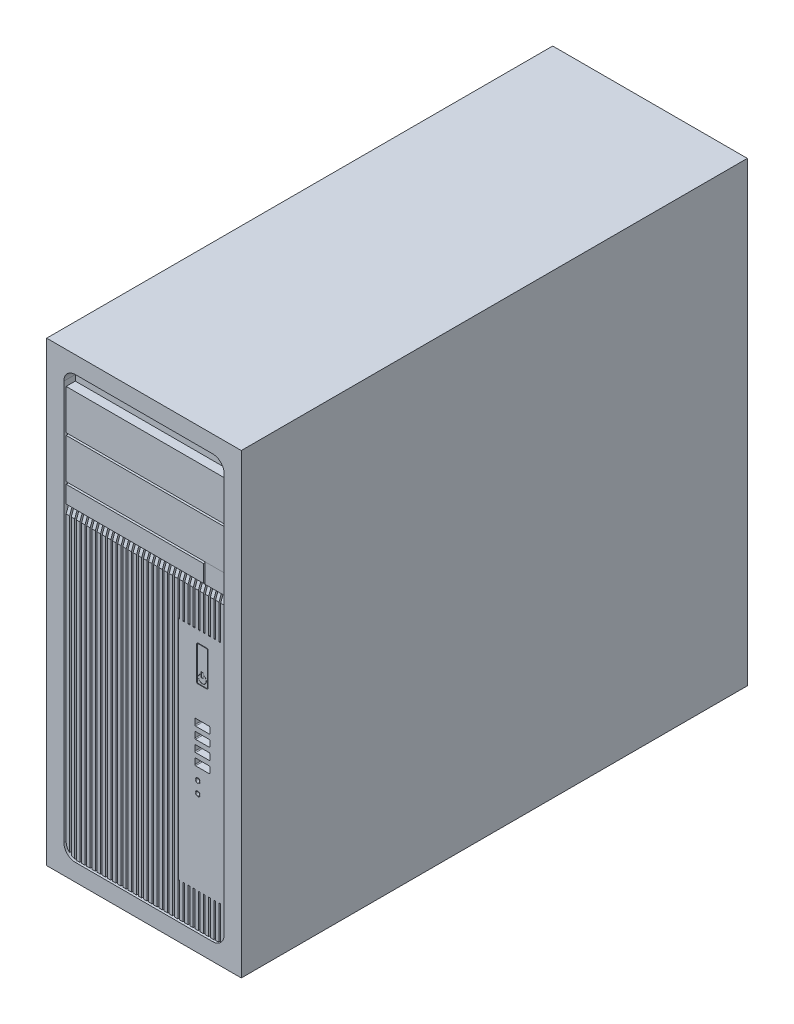
from build123d import *

# Parameters (mm, degrees)
SKETCH1_W             = 170
SKETCH1_H             = 442
BOSS_EXTRUDE1_DEPTH   = 399
CUT_EXTRUDE1_DEPTH    = 10
SKETCH3_W             = 140
SKETCH3_H             = 35
BOSS_EXTRUDE2_DEPTH   = 8
SKETCH4_W             = 120
SKETCH4_H             = 15
BOSS_EXTRUDE3_DEPTH   = 8
SKETCH4_W_2           = 18.906176259
SKETCH4_H_2           = 17
BOSS_EXTRUDE3_2_DEPTH = 8
BOSS_EXTRUDE4_START   = 8
BOSS_EXTRUDE4_DEPTH   = 8
CHAMFER1_SIZE         = 2
CHAMFER1_SIZE2        = 5.494954839
CUT_EXTRUDE2_DEPTH    = 8
SKETCH7_W             = 1.5
SKETCH7_H             = 263
CUT_EXTRUDE3_DEPTH    = 8
BOSS_EXTRUDE5_DEPTH   = 8
SKETCH9_W             = 42
SKETCH9_H             = 197.505045161
BOSS_EXTRUDE6_DEPTH   = 8
CUT_EXTRUDE4_DEPTH    = 8
SKETCH11_W            = 2
SKETCH11_H            = 4.4
SKETCH11_W_2          = 1.6
SKETCH11_H_2          = 4
CUT_EXTRUDE5_DEPTH    = 1
CUT_EXTRUDE6_DEPTH    = 8
SKETCH14_R            = 2.1
SKETCH14_R_2          = 1.9
SKETCH14_R_3          = 1.7
CUT_EXTRUDE7_DEPTH    = 8


with BuildPart() as part:
    # Sketch1 → Boss-Extrude1 (new body)
    with BuildSketch(Plane(origin=(0, 0, 0), x_dir=(1, 0, 0), z_dir=(0, 1, 0))):
        Rectangle(SKETCH1_W, SKETCH1_H)
    extrude(amount=BOSS_EXTRUDE1_DEPTH)

    # Sketch2 → Cut-Extrude1 (cut)
    with BuildSketch(Plane.XY.offset(221)):
        with BuildLine():
            Line((-60, 15), (60, 15))
            ThreePointArc((60, 15), (67.071067812, 17.928932188), (70, 25))
            Line((70, 25), (70, 374))
            ThreePointArc((70, 374), (67.071067812, 381.071067812), (60, 384))
            Line((60, 384), (-60, 384))
            ThreePointArc((-60, 384), (-67.071067812, 381.071067812), (-70, 374))
            Line((-70, 374), (-70, 25))
            ThreePointArc((-70, 25), (-67.071067812, 17.928932188), (-60, 15))
        make_face()
    extrude(amount=-CUT_EXTRUDE1_DEPTH, mode=Mode.SUBTRACT)

    # Sketch3 → Boss-Extrude2 (add)
    with BuildSketch(Plane.XY.offset(211)):
        with Locations((0, 351.5)):
            Rectangle(SKETCH3_W, SKETCH3_H)
        with Locations((0, 314.5)):
            Rectangle(SKETCH3_W, SKETCH3_H)
    extrude(amount=BOSS_EXTRUDE2_DEPTH)

    # Sketch5 → Boss-Extrude4 (add)
    with BuildSketch(Plane.XY.offset(211).offset(BOSS_EXTRUDE4_START)):
        with BuildLine():
            Line((-60, 15), (60, 15))
            ThreePointArc((60, 15), (67.071067812, 17.928932188), (70, 25))
            Line((70, 25), (70, 278))
            Line((70, 278), (-70, 278))
            Line((-70, 278), (-70, 25))
            ThreePointArc((-70, 25), (-67.071067812, 17.928932188), (-60, 15))
        make_face()
    extrude(amount=-BOSS_EXTRUDE4_DEPTH)

    # Chamfer1
    chamfer1_edges = [part.edges().sort_by_distance(p)[0] for p in [
        (0, 278, 219),
    ]]
    chamfer1_side = [part.faces().sort_by_distance(p)[0] for p in [
        (0, 278, 215),
    ]]
    chamfer(chamfer1_edges, length=CHAMFER1_SIZE, length2=CHAMFER1_SIZE2, reference=chamfer1_side[0])

    # Sketch6 → Cut-Extrude2 (cut)
    with BuildSketch(Plane.XY.offset(219)):
        with BuildLine():
            Line((-65.5, 278), (-67, 278))
            Line((-67, 278), (-67, 17.858571571))
            ThreePointArc((-67, 17.858571571), (-66.279224233, 17.217240655), (-65.5, 16.648353456))
            Line((-65.5, 16.648353456), (-65.5, 278))
        make_face()
    extrude(amount=-CUT_EXTRUDE2_DEPTH, mode=Mode.SUBTRACT)

    # Sketch7 → Cut-Extrude3 (cut)
    with BuildSketch(Plane.XY.offset(219)):
        with Locations((-61.75, 146.5)):
            Rectangle(SKETCH7_W, SKETCH7_H)
        with Locations((-57.25, 146.5)):
            Rectangle(SKETCH7_W, SKETCH7_H)
        with Locations((-52.75, 146.5)):
            Rectangle(SKETCH7_W, SKETCH7_H)
        with Locations((-48.25, 146.5)):
            Rectangle(SKETCH7_W, SKETCH7_H)
        with Locations((-43.75, 146.5)):
            Rectangle(SKETCH7_W, SKETCH7_H)
        with Locations((-39.25, 146.5)):
            Rectangle(SKETCH7_W, SKETCH7_H)
        with Locations((-34.75, 146.5)):
            Rectangle(SKETCH7_W, SKETCH7_H)
        with Locations((-30.25, 146.5)):
            Rectangle(SKETCH7_W, SKETCH7_H)
        with Locations((-25.75, 146.5)):
            Rectangle(SKETCH7_W, SKETCH7_H)
        with Locations((-21.25, 146.5)):
            Rectangle(SKETCH7_W, SKETCH7_H)
        with Locations((-16.75, 146.5)):
            Rectangle(SKETCH7_W, SKETCH7_H)
        with Locations((-12.25, 146.5)):
            Rectangle(SKETCH7_W, SKETCH7_H)
        with Locations((-7.75, 146.5)):
            Rectangle(SKETCH7_W, SKETCH7_H)
        with Locations((-3.25, 146.5)):
            Rectangle(SKETCH7_W, SKETCH7_H)
        with Locations((1.25, 146.5)):
            Rectangle(SKETCH7_W, SKETCH7_H)
        with Locations((5.75, 146.5)):
            Rectangle(SKETCH7_W, SKETCH7_H)
        with Locations((10.25, 146.5)):
            Rectangle(SKETCH7_W, SKETCH7_H)
        with Locations((14.75, 146.5)):
            Rectangle(SKETCH7_W, SKETCH7_H)
        with Locations((19.25, 146.5)):
            Rectangle(SKETCH7_W, SKETCH7_H)
        with Locations((23.75, 146.5)):
            Rectangle(SKETCH7_W, SKETCH7_H)
        with Locations((28.25, 146.5)):
            Rectangle(SKETCH7_W, SKETCH7_H)
        with Locations((32.75, 146.5)):
            Rectangle(SKETCH7_W, SKETCH7_H)
        with Locations((37.25, 146.5)):
            Rectangle(SKETCH7_W, SKETCH7_H)
        with Locations((41.75, 146.5)):
            Rectangle(SKETCH7_W, SKETCH7_H)
        with Locations((46.25, 146.5)):
            Rectangle(SKETCH7_W, SKETCH7_H)
        with Locations((50.75, 146.5)):
            Rectangle(SKETCH7_W, SKETCH7_H)
        with Locations((55.25, 146.5)):
            Rectangle(SKETCH7_W, SKETCH7_H)
        with Locations((59.75, 146.5)):
            Rectangle(SKETCH7_W, SKETCH7_H)
        with Locations((64.25, 146.5)):
            Rectangle(SKETCH7_W, SKETCH7_H)
        with Locations((68.75, 146.5)):
            Rectangle(SKETCH7_W, SKETCH7_H)
    extrude(amount=-CUT_EXTRUDE3_DEPTH, mode=Mode.SUBTRACT)

    # Sketch8 → Boss-Extrude5 (add)
    with BuildSketch(Plane.XY.offset(219)):
        with BuildLine():
            ThreePointArc((60.5, 15.012507822), (60.250078211, 15.003127445), (60, 15))
            Line((60, 15), (70, 15))
            Line((70, 15), (70, 25))
            ThreePointArc((70, 25), (68.215838363, 19.299122875), (63.5, 15.632503002))
            ThreePointArc((63.5, 15.632503002), (62.023882039, 15.206946263), (60.5, 15.012507822))
        make_face()
    extrude(amount=-BOSS_EXTRUDE5_DEPTH)

    # Sketch9 → Boss-Extrude6 (add)
    with BuildSketch(Plane.XY.offset(219)):
        with Locations((49, 143.75252258)):
            Rectangle(SKETCH9_W, SKETCH9_H)
    extrude(amount=-BOSS_EXTRUDE6_DEPTH)

    # Sketch10 → Cut-Extrude4 (cut)
    with BuildSketch(Plane.XY.offset(219)):
        with BuildLine():
            Line((45.057177858, 201.505045161), (52.942822142, 201.505045161))
            ThreePointArc((52.942822142, 201.505045161), (53.649928923, 201.79793838), (53.942822142, 202.505045161))
            Line((53.942822142, 202.505045161), (53.942822142, 231.505045161))
            ThreePointArc((53.942822142, 231.505045161), (53.649928923, 232.212151942), (52.942822142, 232.505045161))
            Line((52.942822142, 232.505045161), (45.057177858, 232.505045161))
            ThreePointArc((45.057177858, 232.505045161), (44.350071077, 232.212151942), (44.057177858, 231.505045161))
            Line((44.057177858, 231.505045161), (44.057177858, 202.505045161))
            ThreePointArc((44.057177858, 202.505045161), (44.350071077, 201.79793838), (45.057177858, 201.505045161))
        make_face()
        with BuildLine():
            Line((45.557177858, 202.005045161), (52.442822142, 202.005045161))
            ThreePointArc((52.442822142, 202.005045161), (53.149928923, 202.29793838), (53.442822142, 203.005045161))
            Line((53.442822142, 203.005045161), (53.442822142, 231.005045161))
            ThreePointArc((53.442822142, 231.005045161), (53.149928923, 231.712151942), (52.442822142, 232.005045161))
            Line((52.442822142, 232.005045161), (45.557177858, 232.005045161))
            ThreePointArc((45.557177858, 232.005045161), (44.850071077, 231.712151942), (44.557177858, 231.005045161))
            Line((44.557177858, 231.005045161), (44.557177858, 203.005045161))
            ThreePointArc((44.557177858, 203.005045161), (44.850071077, 202.29793838), (45.557177858, 202.005045161))
        make_face(mode=Mode.SUBTRACT)
    extrude(amount=-CUT_EXTRUDE4_DEPTH, mode=Mode.SUBTRACT)

    # Sketch11 → Cut-Extrude5 (cut)
    # profile 1 of 2: a face of its own
    with BuildSketch(Plane.XY.offset(219)):
        with BuildLine():
            ThreePointArc((47.467219873, 210.15156468), (49, 203.505045161), (50.532780127, 210.15156468))
            Line((50.532780127, 210.15156468), (50.532780127, 209.927473104))
            ThreePointArc((50.532780127, 209.927473104), (49, 203.705045161), (47.467219873, 209.927473104))
            Line((47.467219873, 209.927473104), (47.467219873, 210.15156468))
        make_face()
    # profile 2 of 2: a face of its own
    with BuildSketch(Plane.XY.offset(219)):
        with Locations((49, 210.005045161)):
            Rectangle(SKETCH11_W, SKETCH11_H)
        with Locations((49, 210.005045161)):
            Rectangle(SKETCH11_W_2, SKETCH11_H_2, mode=Mode.SUBTRACT)
    extrude(amount=-CUT_EXTRUDE5_DEPTH, mode=Mode.SUBTRACT)

    # Sketch13 → Cut-Extrude6 (cut)
    with BuildSketch(Plane.XY.offset(219)):
        with BuildLine():
            ThreePointArc((42.35, 169.305045161), (42.572598846, 168.767644007), (43.11, 168.545045161))
            Line((43.11, 168.545045161), (54.89, 168.545045161))
            ThreePointArc((54.89, 168.545045161), (55.427401154, 168.767644007), (55.65, 169.305045161))
            Line((55.65, 169.305045161), (55.65, 173.705045161))
            ThreePointArc((55.65, 173.705045161), (55.427401154, 174.242446315), (54.89, 174.465045161))
            Line((54.89, 174.465045161), (43.11, 174.465045161))
            ThreePointArc((43.11, 174.465045161), (42.572598846, 174.242446315), (42.35, 173.705045161))
            Line((42.35, 173.705045161), (42.35, 169.305045161))
        make_face()
        with BuildLine():
            Line((42.35, 163.705045161), (42.35, 159.305045161))
            ThreePointArc((42.35, 159.305045161), (42.572598846, 158.767644007), (43.11, 158.545045161))
            Line((43.11, 158.545045161), (54.89, 158.545045161))
            ThreePointArc((54.89, 158.545045161), (55.427401154, 158.767644007), (55.65, 159.305045161))
            Line((55.65, 159.305045161), (55.65, 163.705045161))
            ThreePointArc((55.65, 163.705045161), (55.427401154, 164.242446315), (54.89, 164.465045161))
            Line((54.89, 164.465045161), (43.11, 164.465045161))
            ThreePointArc((43.11, 164.465045161), (42.572598846, 164.242446315), (42.35, 163.705045161))
        make_face()
        with BuildLine():
            Line((42.35, 153.705045161), (42.35, 149.305045161))
            ThreePointArc((42.35, 149.305045161), (42.572598846, 148.767644007), (43.11, 148.545045161))
            Line((43.11, 148.545045161), (54.89, 148.545045161))
            ThreePointArc((54.89, 148.545045161), (55.427401154, 148.767644007), (55.65, 149.305045161))
            Line((55.65, 149.305045161), (55.65, 153.705045161))
            ThreePointArc((55.65, 153.705045161), (55.427401154, 154.242446315), (54.89, 154.465045161))
            Line((54.89, 154.465045161), (43.11, 154.465045161))
            ThreePointArc((43.11, 154.465045161), (42.572598846, 154.242446315), (42.35, 153.705045161))
        make_face()
        with BuildLine():
            Line((42.35, 143.705045161), (42.35, 139.305045161))
            ThreePointArc((42.35, 139.305045161), (42.572598846, 138.767644007), (43.11, 138.545045161))
            Line((43.11, 138.545045161), (54.89, 138.545045161))
            ThreePointArc((54.89, 138.545045161), (55.427401154, 138.767644007), (55.65, 139.305045161))
            Line((55.65, 139.305045161), (55.65, 143.705045161))
            ThreePointArc((55.65, 143.705045161), (55.427401154, 144.242446315), (54.89, 144.465045161))
            Line((54.89, 144.465045161), (43.11, 144.465045161))
            ThreePointArc((43.11, 144.465045161), (42.572598846, 144.242446315), (42.35, 143.705045161))
        make_face()
    extrude(amount=-CUT_EXTRUDE6_DEPTH, mode=Mode.SUBTRACT)

    # Sketch14 → Cut-Extrude7 (cut)
    # profile 1 of 4: a face of its own
    with BuildSketch(Plane.XY.offset(219)):
        with Locations((44.980068853, 128.330572484)):
            Circle(SKETCH14_R)
        with Locations((44.980068853, 128.330572484)):
            Circle(SKETCH14_R_2, mode=Mode.SUBTRACT)
    # profile 2 of 4: a face of its own
    with BuildSketch(Plane.XY.offset(219)):
        with Locations((44.980068853, 118.330572484)):
            Circle(SKETCH14_R)
        with Locations((44.980068853, 118.330572484)):
            Circle(SKETCH14_R_2, mode=Mode.SUBTRACT)
    # profile 3 of 4: a face of its own
    with BuildSketch(Plane.XY.offset(219)):
        with Locations((44.980068853, 128.330572484)):
            Circle(SKETCH14_R_3)
    # profile 4 of 4: a face of its own
    with BuildSketch(Plane.XY.offset(219)):
        with Locations((44.980068853, 118.330572484)):
            Circle(SKETCH14_R_3)
    extrude(amount=-CUT_EXTRUDE7_DEPTH, mode=Mode.SUBTRACT)


with BuildPart() as body_2:
    # Sketch4 → Boss-Extrude3 (new body)
    with BuildSketch(Plane.XY.offset(211)):
        with Locations((-10, 287.5)):
            Rectangle(SKETCH4_W, SKETCH4_H)
    extrude(amount=BOSS_EXTRUDE3_DEPTH)


with BuildPart() as body_3:
    # Sketch4 → Boss-Extrude3 2 (new body)
    with BuildSketch(Plane.XY.offset(211)):
        with Locations((60.54691187, 288.5)):
            Rectangle(SKETCH4_W_2, SKETCH4_H_2)
    extrude(amount=BOSS_EXTRUDE3_2_DEPTH)


solid = Compound([part.part, body_2.part, body_3.part])
